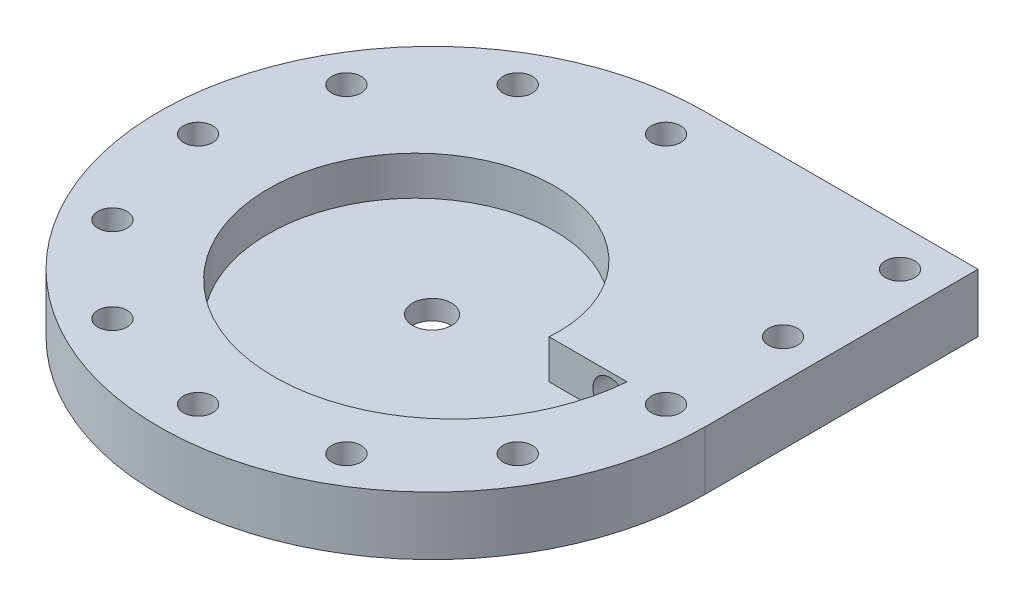
from build123d import *

# Parameters (mm, degrees)
SKETCH1_R           = 6.35
BOSS_EXTRUDE1_DEPTH = 19.05
SKETCH1_3_R         = 6.35
CUT_EXTRUDE1_DEPTH  = 12.7
SKETCH2_R           = 5.55625
CUT_EXTRUDE3_DEPTH  = 128.158651045
CIRPATTERN1_COUNT   = 12
LPATTERN1_COUNT     = 3
LPATTERN1_PITCH     = 38.1


with BuildPart() as part:
    # Sketch1 → Boss-Extrude1 (new body)
    with BuildSketch(Plane(origin=(0, 0, 0), x_dir=(1, 0, 0), z_dir=(0, 1, 0))):
        with BuildLine():
            ThreePointArc((0, 88.9), (-62.861792847, -62.861792847), (88.9, 0))
            Line((88.9, 0), (88.9, 88.9))
            Line((88.9, 88.9), (0, 88.9))
        make_face()
        Circle(SKETCH1_R, mode=Mode.SUBTRACT)
    extrude(amount=-BOSS_EXTRUDE1_DEPTH)

    # Sketch1<3> → Cut-Extrude1 (cut)
    with BuildSketch(Plane(origin=(0, 0, 0), x_dir=(1, 0, 0), z_dir=(0, 1, 0))):
        with BuildLine():
            Line((63.5, 0), (38.1, 0))
            add(Edge.make_bspline(
                [(38.1, 0), (38.105587193, 0.068722808), (38.116325604, 0.206453553), (38.135340693, 0.465748884), (38.158029917, 0.812554362), (38.180442293, 1.215161744), (38.201576344, 1.695012179), (38.219136832, 2.265967597), (38.227706773, 2.911708971), (38.225622425, 3.560725647), (38.21251541, 4.208111771), (38.182595479, 5.017770694), (38.124938299, 5.987975028), (38.026122299, 7.117886192), (37.870127882, 8.404578299), (37.671379205, 9.685438589), (37.430201393, 10.958946928), (37.146979439, 12.223794965), (36.497285101, 14.733367301), (35.339844616, 18.111026129), (33.404320503, 22.230967719), (30.381770702, 26.853321933), (27.005727021, 30.80532088), (23.158149755, 34.299482707), (18.904443759, 37.28547439), (14.314355969, 39.722373456), (9.460672857, 41.578834635), (4.417965212, 42.833098974), (-0.738611101, 43.472848816), (-5.934431214, 43.494968116), (-11.096477665, 42.905063819), (-16.154244909, 41.717127055), (-21.04066678, 39.952723478), (-26.855774459, 37.062674021), (-33.249068246, 32.569133237), (-39.623634518, 26.009997452), (-45.09387077, 17.106053432), (-48.725553808, 6.659901541), (-49.892190833, -4.355955222), (-48.570564895, -15.349899822), (-44.883485591, -25.767221527), (-39.504033355, -34.710630384), (-32.471215816, -42.418698042), (-24.080020499, -48.617101877), (-14.662415393, -53.100258517), (-4.572140039, -55.734075458), (5.829418782, -56.455186476), (14.891779783, -55.416477062), (22.419884811, -53.375548994), (28.436093259, -50.946236894), (33.057914377, -48.584111434), (37.453987706, -45.824720751), (41.592233775, -42.692031522), (45.443184327, -39.212379503), (48.980161235, -35.414130163), (52.179353957, -31.32742912), (55.019915507, -26.98389493), (57.484004128, -22.416349813), (59.297714546, -18.253261888), (60.491863587, -14.89295558), (61.240868669, -12.411242452), (61.666047325, -10.848007272), (61.980317826, -9.590677857), (62.268628146, -8.327123835), (62.53089523, -7.057944956), (62.737539761, -5.942877269), (62.89830352, -4.984347354), (63.02137199, -4.183666322), (63.113242271, -3.542523467), (63.198639909, -2.899423538), (63.277225111, -2.258571229), (63.340956418, -1.688380894), (63.385783315, -1.258245808), (63.41760691, -0.93123611), (63.449651742, -0.587936608), (63.474320152, -0.307392116), (63.488825586, -0.137445952), (63.5, 0)],
                knots=[0.063590465, 0.063590465, 0.063590465, 0.063590465, 0.063590465, 0.064470339, 0.065350213, 0.066230087, 0.067109962, 0.06886971, 0.070629458, 0.072389206, 0.074148954, 0.075908703, 0.077668451, 0.081187947, 0.084707444, 0.08822694, 0.091746437, 0.095265941, 0.098785445, 0.102304949, 0.119902469, 0.13398047, 0.14805847, 0.162136479, 0.176214489, 0.19029251, 0.204370531, 0.218448556, 0.23252658, 0.246604621, 0.260682662, 0.274760682, 0.288838702, 0.302916741, 0.316994781, 0.345150755, 0.373306777, 0.401462812, 0.429618825, 0.464375771, 0.492531786, 0.5206878, 0.548843785, 0.576999769, 0.605155768, 0.633311767, 0.66146779, 0.689623812, 0.717779829, 0.731857837, 0.745935846, 0.760013849, 0.774091853, 0.788169856, 0.80224786, 0.816325863, 0.830403867, 0.84448187, 0.858559874, 0.872637894, 0.879676904, 0.883196409, 0.886715915, 0.89023542, 0.893754925, 0.89727443, 0.900793935, 0.902553688, 0.90431344, 0.906073193, 0.907832945, 0.909592698, 0.91135245, 0.912232327, 0.912672265, 0.913112203, 0.914871956, 0.914871956, 0.914871956, 0.914871956, 0.914871956], degree=4))
        make_face()
        Circle(SKETCH1_3_R, mode=Mode.SUBTRACT)
    extrude(amount=-CUT_EXTRUDE1_DEPTH, mode=Mode.SUBTRACT)

    # Sketch2 → Cut-Extrude3 (cut, through all)
    with BuildSketch(Plane.XY):
        with Locations((57.94375, -7.14375)):
            Circle(SKETCH2_R)
    extrude(amount=-CUT_EXTRUDE3_DEPTH, mode=Mode.SUBTRACT)

    # Sketch3 → 3/8 (0.375) Diameter Hole1 (revolve, cut)
    with BuildSketch(Plane(origin=(76.2, 0, 0), x_dir=(0, 0, 1), z_dir=(1, 0, 0))):
        Polygon((0, 0), (0, 79.061598698), (4.7625, 76.2), (4.7625, 0), align=None)
    f_3_8_0_375_diameter_hole1 = revolve(axis=Axis((76.2, 6.35, 0), (0, -1, 0)), mode=Mode.SUBTRACT)

    # CirPattern1: 3/8 (0.375) Diameter Hole1 ×12 about axis, 2 skipped
    cirpattern1_axis = Axis((0, -19.05, 0), (0, 1, 0))
    add([f_3_8_0_375_diameter_hole1.rotate(cirpattern1_axis, i * 360 / CIRPATTERN1_COUNT) for i in range(1, CIRPATTERN1_COUNT) if i not in (1, 2)], mode=Mode.SUBTRACT)

    # LPattern1: 3/8 (0.375) Diameter Hole1 ×3
    with Locations(*[(0, 0, -i * LPATTERN1_PITCH) for i in range(1, LPATTERN1_COUNT)]):
        add(f_3_8_0_375_diameter_hole1, mode=Mode.SUBTRACT)


solid = part.part
